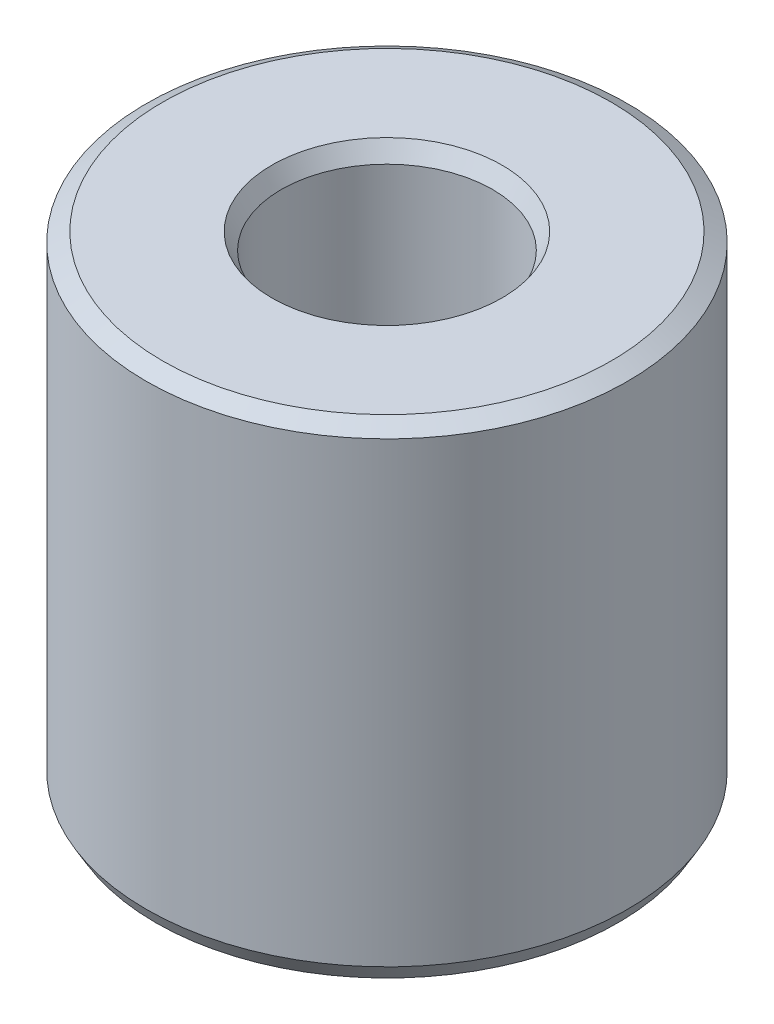
from build123d import *
from OCP.BRepFilletAPI import BRepFilletAPI_MakeChamfer

# Parameters (mm, degrees)
SKETCH1_R           = 7.5
BOSS_EXTRUDE1_DEPTH = 15.057082346
SKETCH2_R           = 3.293634676
CUT_EXTRUDE1_DEPTH  = 19.417810097
CHAMFER1_SIZE       = 0.294537914
CHAMFER1_SIZE2      = 0.510154632


with BuildPart() as part:
    # Sketch1 → Boss-Extrude1 (new body)
    with BuildSketch(Plane(origin=(0, 0, 0), x_dir=(1, 0, 0), z_dir=(0, 1, 0))):
        Circle(SKETCH1_R)
    extrude(amount=BOSS_EXTRUDE1_DEPTH)

    # Sketch2 → Cut-Extrude1 (cut, through all)
    with BuildSketch(Plane(origin=(0, 0, 0), x_dir=(1, 0, 0), z_dir=(0, 1, 0))):
        Circle(SKETCH2_R)
    extrude(amount=CUT_EXTRUDE1_DEPTH, mode=Mode.SUBTRACT)

    # Chamfer1: one chamfer whose edges measure the first distance from different faces: ONE call of the kernel's chamfer builder (chamfer() names one face for all edges)
    chamfer1_edges_1 = [part.edges().sort_by_distance(p)[0] for p in [
        (-3.293634676, 15.057082346, 0),
    ]]
    chamfer1_side_1 = [part.faces().sort_by_distance(p)[0] for p in [
        (-7.287867966, 15.057082346, 0),
    ]]
    chamfer1_edges_2 = [part.edges().sort_by_distance(p)[0] for p in [
        (-3.293634676, 0, 0),
    ]]
    chamfer1_side_2 = [part.faces().sort_by_distance(p)[0] for p in [
        (-3.293634676, 7.528541173, 0),
    ]]
    chamfer1_edges_3 = [part.edges().sort_by_distance(p)[0] for p in [
        (-7.5, 0, 0),
    ]]
    chamfer1_side_3 = [part.faces().sort_by_distance(p)[0] for p in [
        (-7.287867966, 0, 0),
    ]]
    chamfer1_edges_4 = [part.edges().sort_by_distance(p)[0] for p in [
        (-7.5, 15.057082346, 0),
    ]]
    chamfer1_side_4 = [part.faces().sort_by_distance(p)[0] for p in [
        (-7.5, 7.528541173, 0),
    ]]
    chamfer1 = BRepFilletAPI_MakeChamfer(part.part.solid().wrapped)
    for e in chamfer1_edges_1:
        chamfer1.Add(CHAMFER1_SIZE, CHAMFER1_SIZE2, e.wrapped, chamfer1_side_1[0].wrapped)  # the first distance lies on this face
    for e in chamfer1_edges_2:
        chamfer1.Add(CHAMFER1_SIZE, CHAMFER1_SIZE2, e.wrapped, chamfer1_side_2[0].wrapped)  # the first distance lies on this face
    for e in chamfer1_edges_3:
        chamfer1.Add(CHAMFER1_SIZE, CHAMFER1_SIZE2, e.wrapped, chamfer1_side_3[0].wrapped)  # the first distance lies on this face
    for e in chamfer1_edges_4:
        chamfer1.Add(CHAMFER1_SIZE, CHAMFER1_SIZE2, e.wrapped, chamfer1_side_4[0].wrapped)  # the first distance lies on this face
    add(Compound.cast(chamfer1.Shape()), mode=Mode.REPLACE)


solid = part.part
